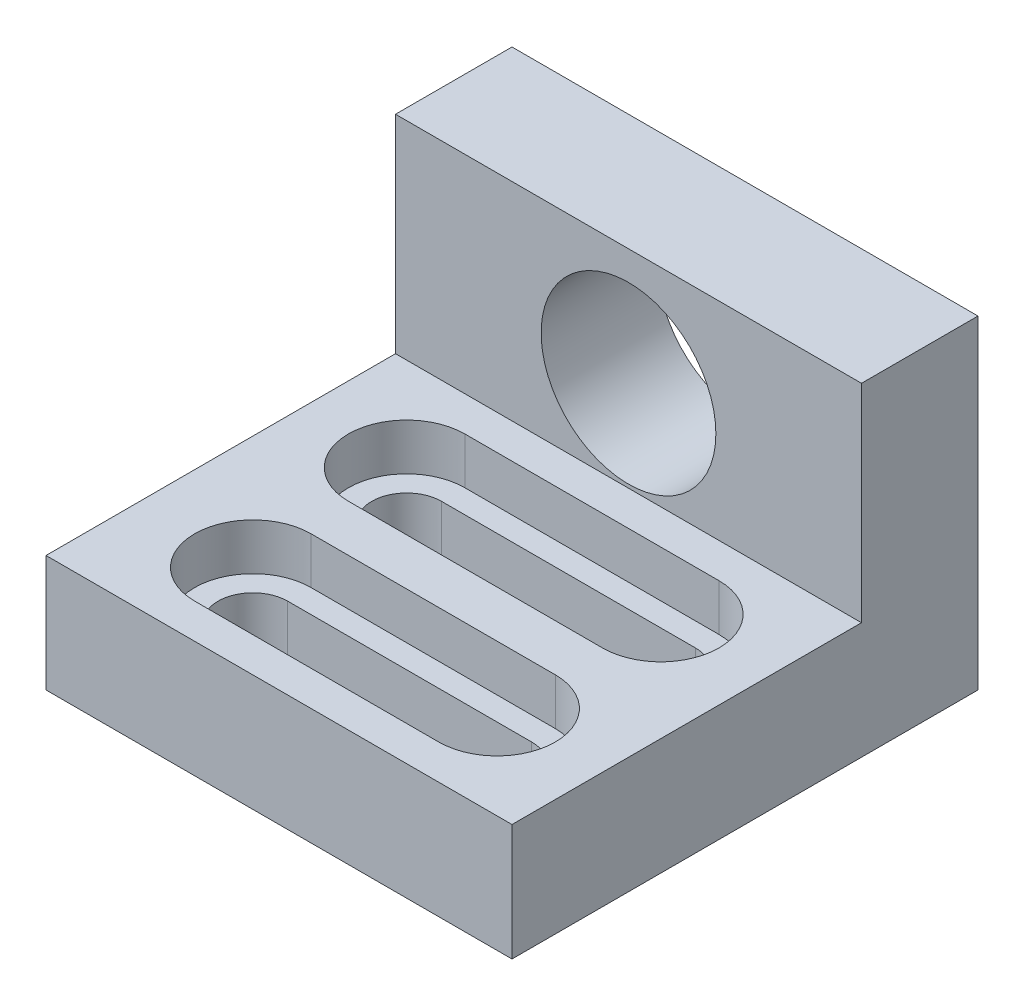
from build123d import *

# Parameters (mm, degrees)
SKETCH1_R           = 4.7625
BOSS_EXTRUDE1_DEPTH = 6.35
SKETCH2_W           = 25.4
SKETCH2_H           = 6.35
BOSS_EXTRUDE2_DEPTH = 19.05
CUT_EXTRUDE1_DEPTH  = 2.54
CUT_EXTRUDE2_DEPTH  = 31.56481325


with BuildPart() as part:
    # Sketch1 → Boss-Extrude1 (new body)
    with BuildSketch(Plane.XY):
        Polygon((-12.7, 0), (-12.7, -11.303), (12.7, -11.303), (12.7, 0), (12.7, 6.35), (-12.7, 6.35), align=None)
        Circle(SKETCH1_R, mode=Mode.SUBTRACT)
    extrude(amount=BOSS_EXTRUDE1_DEPTH)

    # Sketch2 → Boss-Extrude2 (add)
    with BuildSketch(Plane.XY.offset(6.35)):
        with Locations((0, -8.128)):
            Rectangle(SKETCH2_W, SKETCH2_H)
    extrude(amount=BOSS_EXTRUDE2_DEPTH)

    # Sketch8 → Cut-Extrude1 (cut)
    with BuildSketch(Plane(origin=(0, -4.953, 0), x_dir=(1, 0, 0), z_dir=(0, 1, 0))):
        with BuildLine():
            Line((6.831878573, -8.24865), (-7.020996319, -8.24865))
            ThreePointArc((-7.020996319, -8.24865), (-10.195996319, -11.42365), (-7.020996319, -14.59865))
            Line((-7.020996319, -14.59865), (6.831878573, -14.59865))
            ThreePointArc((6.831878573, -14.59865), (10.006878573, -11.42365), (6.831878573, -8.24865))
        make_face()
        with BuildLine():
            Line((6.810995401, -17.152034443), (-6.498165971, -17.152034443))
            ThreePointArc((-6.498165971, -17.152034443), (-9.673165971, -20.327034443), (-6.498165971, -23.502034443))
            Line((-6.498165971, -23.502034443), (6.810995401, -23.502034443))
            ThreePointArc((6.810995401, -23.502034443), (9.985995401, -20.327034443), (6.810995401, -17.152034443))
        make_face()
    extrude(amount=-CUT_EXTRUDE1_DEPTH, mode=Mode.SUBTRACT)

    # Sketch8<12> → Cut-Extrude2 (cut, through all)
    with BuildSketch(Plane(origin=(0, -4.953, 0), x_dir=(1, 0, 0), z_dir=(0, 1, 0))):
        with BuildLine():
            Line((6.831878573, -9.525), (-7.020996319, -9.525))
            ThreePointArc((-7.020996319, -9.525), (-8.919646319, -11.42365), (-7.020996319, -13.3223))
            Line((-7.020996319, -13.3223), (6.831878573, -13.3223))
            ThreePointArc((6.831878573, -13.3223), (8.730528573, -11.42365), (6.831878573, -9.525))
        make_face()
        with BuildLine():
            Line((6.792970181, -18.428384443), (-6.498165971, -18.428384443))
            ThreePointArc((-6.498165971, -18.428384443), (-8.396644853, -20.352524805), (-6.447189842, -22.225))
            Line((-6.447189842, -22.225), (6.865064563, -22.225))
            ThreePointArc((6.865064563, -22.225), (8.709388725, -20.290985627), (6.792970181, -18.428384443))
        make_face()
    extrude(amount=-CUT_EXTRUDE2_DEPTH, mode=Mode.SUBTRACT)


solid = part.part
